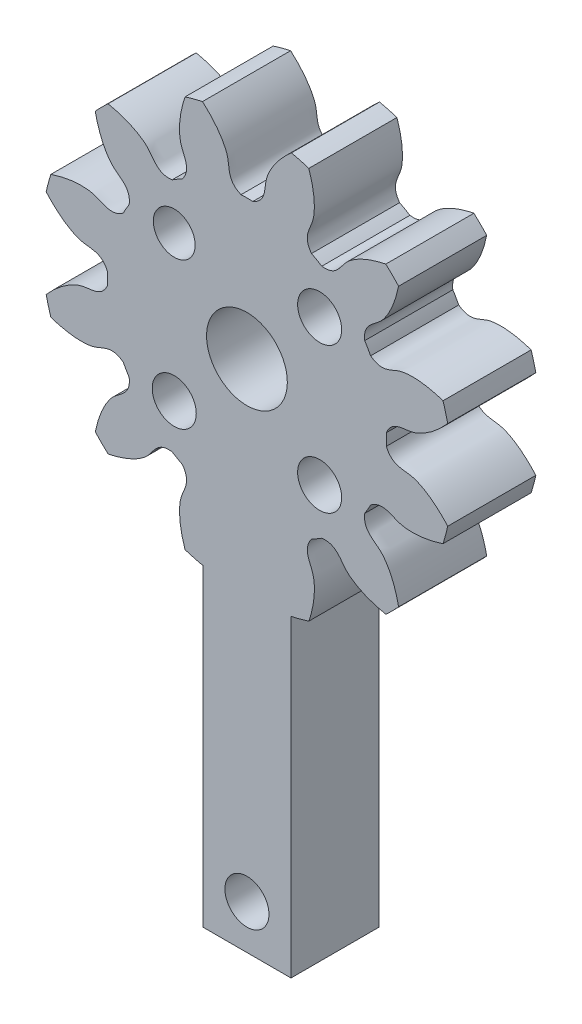
from build123d import *

# Parameters (mm, degrees)
SKETCH_1_R               = 14
EXTRUDE_1_DEPTH          = 30
CUT_EXTRUDE_1_DEPTH      = 36.944401511
PATTERN_CIRCULAR_1_COUNT = 12
SKETCH_4_R               = 1.5
SKETCH_4_R_2             = 1.423680872
CUT_EXTRUDE_2_DEPTH      = 10
CUT_EXTRUDE_3_DEPTH      = 24
SKETCH_6_R               = 2.75
CUT_EXTRUDE_4_DEPTH      = 24
SKETCH_9_W               = 6
SKETCH_9_H               = 30
EXTRUDE_2_DEPTH          = 6
SKETCH_10_R              = 1.5
CUT_EXTRUDE_5_DEPTH      = 10


with BuildPart() as part:
    # 草图1 → 凸台-拉伸1 (new body)
    with BuildSketch(Plane.XY):
        Circle(SKETCH_1_R)
    extrude(amount=EXTRUDE_1_DEPTH)

    # 草图2 → 切除-拉伸1 (cut, through all)
    with BuildSketch(Plane.XY):
        with BuildLine():
            ThreePointArc((0.401680225, 9.491504254), (0, 9.5), (-0.401680225, 9.491504254))
            add(Edge.make_bspline(
                [(-0.401680225, 9.491504254), (-1.361577738, 9.898614926), (-1.148746958, 10.689637365), (-1.352304376, 11.378961155), (-1.365247708, 11.419811475), (-1.380454501, 11.46466685), (-1.398085738, 11.513452175), (-1.41830525, 11.566086477), (-1.441273032, 11.622484138), (-1.467147122, 11.682554592), (-1.496082862, 11.746202504), (-1.528232954, 11.813327799), (-1.563747275, 11.883825742), (-1.602772771, 11.957587012), (-1.645453327, 12.034497774), (-1.691929648, 12.114439762), (-1.742339142, 12.197290357), (-1.796815797, 12.282922678), (-1.855490069, 12.371205667), (-1.918488769, 12.462004178), (-1.985934952, 12.555179076), (-2.057947808, 12.650587329), (-2.134642556, 12.748082111), (-2.216130341, 12.847512903), (-2.302518131, 12.948725598), (-2.39390862, 13.051562605), (-2.490400133, 13.155862967), (-2.59208653, 13.261462464), (-2.699057115, 13.368193734), (-2.811396554, 13.475886387), (-2.929184784, 13.584367126), (-3.052496933, 13.693459866), (-3.181403243, 13.802985862), (-3.31596899, 13.912763828), (-3.456254416, 14.02261007), (-3.602314655, 14.132338614), (-3.754199671, 14.241761336), (-3.911954189, 14.350688096), (-4.07561764, 14.458926871), (-4.2452241, 14.566283893), (-4.420802241, 14.672563788), (-4.602375278, 14.77756971), (-4.789960922, 14.881103487), (-4.983571339, 14.98296576), (-5.183213107, 15.082956125), (-5.388887185, 15.18087328), (-5.600588875, 15.276515169), (-5.818307792, 15.369679124), (-6.042027853, 15.460162018), (-6.27172721, 15.547760413), (-6.588759411, 15.661455917), (-6.8311872, 15.740202816), (-6.995210805, 15.78994182)],
                knots=[0, 0, 0, 0, 0.218015236, 0.222043642, 0.226545979, 0.231522246, 0.236972443, 0.24289657, 0.249294627, 0.256166614, 0.263512532, 0.271332379, 0.279626157, 0.288393865, 0.297635503, 0.307351072, 0.31754057, 0.328203999, 0.339341357, 0.350952646, 0.363037866, 0.375597015, 0.388630094, 0.402137104, 0.416118043, 0.430572913, 0.445501713, 0.460904444, 0.476781104, 0.493131694, 0.509956215, 0.527254666, 0.545027047, 0.563273358, 0.581993599, 0.601187771, 0.620855872, 0.640997904, 0.661613866, 0.682703758, 0.704267581, 0.726305333, 0.748817015, 0.771802628, 0.795262171, 0.819195644, 0.843603047, 0.868484381, 0.893839644, 0.919668838, 0.945971962, 1, 1, 1, 1], degree=3))
            ThreePointArc((-6.995210805, 15.78994182), (0, 17.270067658), (6.995210805, 15.78994182))
            add(Edge.make_bspline(
                [(0.401680225, 9.491504254), (1.361577738, 9.898614926), (1.148746958, 10.689637365), (1.352304376, 11.378961155), (1.365247708, 11.419811475), (1.380454501, 11.46466685), (1.398085738, 11.513452175), (1.41830525, 11.566086477), (1.441273032, 11.622484138), (1.467147122, 11.682554592), (1.496082862, 11.746202504), (1.528232954, 11.813327799), (1.563747275, 11.883825742), (1.602772771, 11.957587012), (1.645453327, 12.034497774), (1.691929648, 12.114439762), (1.742339142, 12.197290357), (1.796815797, 12.282922678), (1.855490069, 12.371205667), (1.918488769, 12.462004178), (1.985934952, 12.555179076), (2.057947808, 12.650587329), (2.134642556, 12.748082111), (2.216130341, 12.847512903), (2.302518131, 12.948725598), (2.39390862, 13.051562605), (2.490400133, 13.155862967), (2.59208653, 13.261462464), (2.699057115, 13.368193734), (2.811396554, 13.475886387), (2.929184784, 13.584367126), (3.052496933, 13.693459866), (3.181403243, 13.802985862), (3.31596899, 13.912763828), (3.456254416, 14.02261007), (3.602314655, 14.132338614), (3.754199671, 14.241761336), (3.911954189, 14.350688096), (4.07561764, 14.458926871), (4.2452241, 14.566283893), (4.420802241, 14.672563788), (4.602375278, 14.77756971), (4.789960922, 14.881103487), (4.983571339, 14.98296576), (5.183213107, 15.082956125), (5.388887185, 15.18087328), (5.600588875, 15.276515169), (5.818307792, 15.369679124), (6.042027853, 15.460162018), (6.27172721, 15.547760413), (6.588759411, 15.661455917), (6.8311872, 15.740202816), (6.995210805, 15.78994182)],
                knots=[0, 0, 0, 0, 0.218015236, 0.222043642, 0.226545979, 0.231522246, 0.236972443, 0.24289657, 0.249294627, 0.256166614, 0.263512532, 0.271332379, 0.279626157, 0.288393865, 0.297635503, 0.307351072, 0.31754057, 0.328203999, 0.339341357, 0.350952646, 0.363037866, 0.375597015, 0.388630094, 0.402137104, 0.416118043, 0.430572913, 0.445501713, 0.460904444, 0.476781104, 0.493131694, 0.509956215, 0.527254666, 0.545027047, 0.563273358, 0.581993599, 0.601187771, 0.620855872, 0.640997904, 0.661613866, 0.682703758, 0.704267581, 0.726305333, 0.748817015, 0.771802628, 0.795262171, 0.819195644, 0.843603047, 0.868484381, 0.893839644, 0.919668838, 0.945971962, 1, 1, 1, 1], degree=3))
        make_face()
    cut_extrude_1 = extrude(amount=CUT_EXTRUDE_1_DEPTH, mode=Mode.SUBTRACT)

    # 阵列(圆周)1: 切除-拉伸1 ×12 about axis
    pattern_circular_1_axis = Axis((0, 0, -1.50000125), (0, 0, 1))
    for i in range(1, PATTERN_CIRCULAR_1_COUNT):
        add(cut_extrude_1.rotate(pattern_circular_1_axis, i * 360 / PATTERN_CIRCULAR_1_COUNT), mode=Mode.SUBTRACT)

    # 草图4 → 切除-拉伸2 (cut)
    with BuildSketch(Plane.XY.offset(30)):
        with Locations((4.95, 4.95)):
            Circle(SKETCH_4_R)
        with Locations((4.95, -4.95)):
            Circle(SKETCH_4_R)
        with Locations((-4.95, -4.95)):
            Circle(SKETCH_4_R)
        with Locations((-4.95, 4.95)):
            Circle(SKETCH_4_R_2)
    extrude(amount=-CUT_EXTRUDE_2_DEPTH, mode=Mode.SUBTRACT)

    # 草图5 → 切除-拉伸3 (cut)
    with BuildSketch(Plane(origin=(0, 0, 0), x_dir=(-1, 0, 0), z_dir=(0, 0, -1))):
        with BuildLine():
            ThreePointArc((5.093617406, 8.019043691), (4.75, 8.227241336), (4.397886848, 8.420723916))
            add(Edge.make_bspline(
                [(4.397886848, 8.420723916), (3.770146552, 9.253240857), (4.349974635, 9.831870994), (4.52204915, 10.545970243), (4.538144761, 10.623261245), (4.555989488, 10.730054867), (4.571840145, 10.855376167), (4.584238126, 10.99920835), (4.59172634, 11.161446862), (4.592851082, 11.341900315), (4.586167374, 11.540290435), (4.570243427, 11.756252545), (4.543665279, 11.989336212), (4.505041355, 12.239006133), (4.453006992, 12.504643256), (4.386228899, 12.785546114), (4.306544015, 13.06975296), (4.24565022, 13.259118002), (4.214462671, 13.350591912)],
                knots=[0, 0, 0, 0, 0.218015236, 0.222043642, 0.231522246, 0.24289657, 0.256166614, 0.271332379, 0.288393865, 0.307351072, 0.328203999, 0.350952646, 0.375597015, 0.402137104, 0.430572913, 0.460904444, 0.493131694, 0.523595567, 0.523595567, 0.523595567, 0.523595567], degree=3))
            ThreePointArc((4.214462671, 13.350591912), (3.623466631, 13.522961568), (3.02546422, 13.669183087))
            add(Edge.make_bspline(
                [(3.02546422, 13.669183087), (2.913673684, 13.571409302), (2.731554989, 13.403302075), (2.492448157, 13.160132848), (2.304461996, 12.953014593), (2.136483862, 12.752388805), (1.987675315, 12.559502197), (1.857131035, 12.375544097), (1.743882195, 12.201643116), (1.646899875, 12.038864017), (1.565098659, 11.888204746), (1.497340348, 11.750593659), (1.45006317, 11.644068427), (1.411783535, 11.550072327), (1.381482721, 11.469086303), (1.35677568, 11.394102713), (1.148746958, 10.689637365), (1.361577738, 9.898614926), (0.401680225, 9.491504254)],
                knots=[0.476404433, 0.476404433, 0.476404433, 0.476404433, 0.523218896, 0.554498287, 0.583881957, 0.611369906, 0.636962134, 0.660658643, 0.68245943, 0.702364497, 0.720373843, 0.736487468, 0.750705373, 0.75710343, 0.768477754, 0.777956358, 0.781984764, 1, 1, 1, 1], degree=3))
            ThreePointArc((0.401680225, 9.491504254), (0, 9.5), (-0.401680225, 9.491504254))
            add(Edge.make_bspline(
                [(-0.401680225, 9.491504254), (-1.361577738, 9.898614926), (-1.148746958, 10.689637365), (-1.35677568, 11.394102713), (-1.381481974, 11.46908649), (-1.419424798, 11.570494842), (-1.468358376, 11.686951601), (-1.529537501, 11.817712915), (-1.604171774, 11.961959695), (-1.693424445, 12.118799341), (-1.798407765, 12.287268371), (-1.920179363, 12.466335071), (-2.059738548, 12.654902373), (-2.218022808, 12.851810906), (-2.39590445, 13.055842221), (-2.594187404, 13.265722186), (-2.805299961, 13.472010092), (-2.952718055, 13.605558131), (-3.02546422, 13.669183087)],
                knots=[0, 0, 0, 0, 0.218015236, 0.222043642, 0.231522246, 0.24289657, 0.256166614, 0.271332379, 0.288393865, 0.307351072, 0.328203999, 0.350952646, 0.375597015, 0.402137104, 0.430572913, 0.460904444, 0.493131694, 0.523595567, 0.523595567, 0.523595567, 0.523595567], degree=3))
            ThreePointArc((-3.02546422, 13.669183087), (-3.623466631, 13.522961568), (-4.214462671, 13.350591912))
            add(Edge.make_bspline(
                [(-4.214462671, 13.350591912), (-4.262389222, 13.210022063), (-4.336055025, 12.973377586), (-4.421543002, 12.643233442), (-4.480784666, 12.369870692), (-4.525945103, 12.112134595), (-4.558373781, 11.870685619), (-4.579449393, 11.646101091), (-4.590575276, 11.438874004), (-4.593174879, 11.249412009), (-4.588687175, 11.078036645), (-4.57856205, 10.924982792), (-4.566242671, 10.809090647), (-4.552395758, 10.708547818), (-4.53814402, 10.623261457), (-4.52204915, 10.545970243), (-4.349974635, 9.831870994), (-3.770146552, 9.253240857), (-4.397886848, 8.420723916)],
                knots=[0.476404433, 0.476404433, 0.476404433, 0.476404433, 0.523218896, 0.554498287, 0.583881957, 0.611369906, 0.636962134, 0.660658643, 0.68245943, 0.702364497, 0.720373843, 0.736487468, 0.750705373, 0.75710343, 0.768477754, 0.777956358, 0.781984764, 1, 1, 1, 1], degree=3))
            ThreePointArc((-4.397886848, 8.420723916), (-4.75, 8.227241336), (-5.093617406, 8.019043691))
            add(Edge.make_bspline(
                [(-5.093617406, 8.019043691), (-6.128468373, 7.891663119), (-6.33966273, 8.683124036), (-6.872053563, 9.189194563), (-6.930941729, 9.241779272), (-7.014505355, 9.310630069), (-7.115111456, 9.387017791), (-7.23347479, 9.469670849), (-7.370233356, 9.557275088), (-7.525948259, 9.64847587), (-7.701100996, 9.741882669), (-7.896091644, 9.836073182), (-8.111237094, 9.929597664), (-8.346769551, 10.020983326), (-8.602835229, 10.108738806), (-8.879493287, 10.191358711), (-9.165466077, 10.264453), (-9.359907912, 10.306399947), (-9.454720416, 10.325127692)],
                knots=[0, 0, 0, 0, 0.218015236, 0.222043642, 0.231522246, 0.24289657, 0.256166614, 0.271332379, 0.288393865, 0.307351072, 0.328203999, 0.350952646, 0.375597015, 0.402137104, 0.430572913, 0.460904444, 0.493131694, 0.523595567, 0.523595567, 0.523595567, 0.523595567], degree=3))
            ThreePointArc((-9.454720416, 10.325127692), (-9.899494937, 9.899494937), (-10.325127692, 9.454720416))
            add(Edge.make_bspline(
                [(-10.325127692, 9.454720416), (-10.296348379, 9.30902008), (-10.241822597, 9.06724705), (-10.150785285, 8.738589846), (-10.065408695, 8.472229927), (-9.975650733, 8.226443701), (-9.883010304, 8.001128416), (-9.788970056, 7.796094703), (-9.694991809, 7.61106784), (-9.602512134, 7.445689138), (-9.512937986, 7.299517571), (-9.427642444, 7.172031609), (-9.359027476, 7.077825756), (-9.296764283, 6.997676569), (-9.241778736, 6.930942283), (-9.189194563, 6.872053563), (-8.683124036, 6.33966273), (-7.891663119, 6.128468373), (-8.019043691, 5.093617406)],
                knots=[0.476404433, 0.476404433, 0.476404433, 0.476404433, 0.523218896, 0.554498287, 0.583881957, 0.611369906, 0.636962134, 0.660658643, 0.68245943, 0.702364497, 0.720373843, 0.736487468, 0.750705373, 0.75710343, 0.768477754, 0.777956358, 0.781984764, 1, 1, 1, 1], degree=3))
            ThreePointArc((-8.019043691, 5.093617406), (-8.227241336, 4.75), (-8.420723916, 4.397886848))
            add(Edge.make_bspline(
                [(-8.420723916, 4.397886848), (-9.253240857, 3.770146552), (-9.831870994, 4.349974635), (-10.545970243, 4.52204915), (-10.623261245, 4.538144761), (-10.730054867, 4.555989488), (-10.855376167, 4.571840145), (-10.99920835, 4.584238126), (-11.161446862, 4.59172634), (-11.341900315, 4.592851082), (-11.540290435, 4.586167374), (-11.756252545, 4.570243427), (-11.989336212, 4.543665279), (-12.239006133, 4.505041355), (-12.504643256, 4.453006992), (-12.785546114, 4.386228899), (-13.06975296, 4.306544015), (-13.259118002, 4.24565022), (-13.350591912, 4.214462671)],
                knots=[0, 0, 0, 0, 0.218015236, 0.222043642, 0.231522246, 0.24289657, 0.256166614, 0.271332379, 0.288393865, 0.307351072, 0.328203999, 0.350952646, 0.375597015, 0.402137104, 0.430572913, 0.460904444, 0.493131694, 0.523595567, 0.523595567, 0.523595567, 0.523595567], degree=3))
            ThreePointArc((-13.350591912, 4.214462671), (-13.522961568, 3.623466631), (-13.669183087, 3.02546422))
            add(Edge.make_bspline(
                [(-13.669183087, 3.02546422), (-13.571409302, 2.913673684), (-13.403302075, 2.731554989), (-13.160132848, 2.492448157), (-12.953014593, 2.304461996), (-12.752388805, 2.136483862), (-12.559502197, 1.987675315), (-12.375544097, 1.857131035), (-12.201643116, 1.743882195), (-12.038864017, 1.646899875), (-11.888204746, 1.565098659), (-11.750593659, 1.497340348), (-11.644068427, 1.45006317), (-11.550072327, 1.411783535), (-11.469086303, 1.381482721), (-11.394102713, 1.35677568), (-10.689637365, 1.148746958), (-9.898614926, 1.361577738), (-9.491504254, 0.401680225)],
                knots=[0.476404433, 0.476404433, 0.476404433, 0.476404433, 0.523218896, 0.554498287, 0.583881957, 0.611369906, 0.636962134, 0.660658643, 0.68245943, 0.702364497, 0.720373843, 0.736487468, 0.750705373, 0.75710343, 0.768477754, 0.777956358, 0.781984764, 1, 1, 1, 1], degree=3))
            ThreePointArc((-9.491504254, 0.401680225), (-9.5, 0), (-9.491504254, -0.401680225))
            add(Edge.make_bspline(
                [(-9.491504254, -0.401680225), (-9.898614926, -1.361577738), (-10.689637365, -1.148746958), (-11.394102713, -1.35677568), (-11.46908649, -1.381481974), (-11.570494842, -1.419424798), (-11.686951601, -1.468358376), (-11.817712915, -1.529537501), (-11.961959695, -1.604171774), (-12.118799341, -1.693424445), (-12.287268371, -1.798407765), (-12.466335071, -1.920179363), (-12.654902373, -2.059738548), (-12.851810906, -2.218022808), (-13.055842221, -2.39590445), (-13.265722186, -2.594187404), (-13.472010092, -2.805299961), (-13.605558131, -2.952718055), (-13.669183087, -3.02546422)],
                knots=[0, 0, 0, 0, 0.218015236, 0.222043642, 0.231522246, 0.24289657, 0.256166614, 0.271332379, 0.288393865, 0.307351072, 0.328203999, 0.350952646, 0.375597015, 0.402137104, 0.430572913, 0.460904444, 0.493131694, 0.523595567, 0.523595567, 0.523595567, 0.523595567], degree=3))
            ThreePointArc((-13.669183087, -3.02546422), (-13.522961568, -3.623466631), (-13.350591912, -4.214462671))
            add(Edge.make_bspline(
                [(-13.350591912, -4.214462671), (-13.210022063, -4.262389222), (-12.973377586, -4.336055025), (-12.643233442, -4.421543002), (-12.369870692, -4.480784666), (-12.112134595, -4.525945103), (-11.870685619, -4.558373781), (-11.646101091, -4.579449393), (-11.438874004, -4.590575276), (-11.249412009, -4.593174879), (-11.078036645, -4.588687175), (-10.924982792, -4.57856205), (-10.809090647, -4.566242671), (-10.708547818, -4.552395758), (-10.623261457, -4.53814402), (-10.545970243, -4.52204915), (-9.831870994, -4.349974635), (-9.253240857, -3.770146552), (-8.420723916, -4.397886848)],
                knots=[0.476404433, 0.476404433, 0.476404433, 0.476404433, 0.523218896, 0.554498287, 0.583881957, 0.611369906, 0.636962134, 0.660658643, 0.68245943, 0.702364497, 0.720373843, 0.736487468, 0.750705373, 0.75710343, 0.768477754, 0.777956358, 0.781984764, 1, 1, 1, 1], degree=3))
            ThreePointArc((-8.420723916, -4.397886848), (-8.227241336, -4.75), (-8.019043691, -5.093617406))
            add(Edge.make_bspline(
                [(-8.019043691, -5.093617406), (-7.891663119, -6.128468373), (-8.683124036, -6.33966273), (-9.189194563, -6.872053563), (-9.241779272, -6.930941729), (-9.310630069, -7.014505355), (-9.387017791, -7.115111456), (-9.469670849, -7.23347479), (-9.557275088, -7.370233356), (-9.64847587, -7.525948259), (-9.741882669, -7.701100996), (-9.836073182, -7.896091644), (-9.929597664, -8.111237094), (-10.020983326, -8.346769551), (-10.108738806, -8.602835229), (-10.191358711, -8.879493287), (-10.264453, -9.165466077), (-10.306399947, -9.359907912), (-10.325127692, -9.454720416)],
                knots=[0, 0, 0, 0, 0.218015236, 0.222043642, 0.231522246, 0.24289657, 0.256166614, 0.271332379, 0.288393865, 0.307351072, 0.328203999, 0.350952646, 0.375597015, 0.402137104, 0.430572913, 0.460904444, 0.493131694, 0.523595567, 0.523595567, 0.523595567, 0.523595567], degree=3))
            ThreePointArc((-10.325127692, -9.454720416), (-9.899494937, -9.899494937), (-9.454720416, -10.325127692))
            add(Edge.make_bspline(
                [(-9.454720416, -10.325127692), (-9.30902008, -10.296348379), (-9.06724705, -10.241822597), (-8.738589846, -10.150785285), (-8.472229927, -10.065408695), (-8.226443701, -9.975650733), (-8.001128416, -9.883010304), (-7.796094703, -9.788970056), (-7.61106784, -9.694991809), (-7.445689138, -9.602512134), (-7.299517571, -9.512937986), (-7.172031609, -9.427642444), (-7.077825756, -9.359027476), (-6.997676569, -9.296764283), (-6.930942283, -9.241778736), (-6.872053563, -9.189194563), (-6.33966273, -8.683124036), (-6.128468373, -7.891663119), (-5.093617406, -8.019043691)],
                knots=[0.476404433, 0.476404433, 0.476404433, 0.476404433, 0.523218896, 0.554498287, 0.583881957, 0.611369906, 0.636962134, 0.660658643, 0.68245943, 0.702364497, 0.720373843, 0.736487468, 0.750705373, 0.75710343, 0.768477754, 0.777956358, 0.781984764, 1, 1, 1, 1], degree=3))
            ThreePointArc((-5.093617406, -8.019043691), (-4.75, -8.227241336), (-4.397886848, -8.420723916))
            add(Edge.make_bspline(
                [(-4.397886848, -8.420723916), (-3.770146552, -9.253240857), (-4.349974635, -9.831870994), (-4.52204915, -10.545970243), (-4.538144761, -10.623261245), (-4.555989488, -10.730054867), (-4.571840145, -10.855376167), (-4.584238126, -10.99920835), (-4.59172634, -11.161446862), (-4.592851082, -11.341900315), (-4.586167374, -11.540290435), (-4.570243427, -11.756252545), (-4.543665279, -11.989336212), (-4.505041355, -12.239006133), (-4.453006992, -12.504643256), (-4.386228899, -12.785546114), (-4.306544015, -13.06975296), (-4.24565022, -13.259118002), (-4.214462671, -13.350591912)],
                knots=[0, 0, 0, 0, 0.218015236, 0.222043642, 0.231522246, 0.24289657, 0.256166614, 0.271332379, 0.288393865, 0.307351072, 0.328203999, 0.350952646, 0.375597015, 0.402137104, 0.430572913, 0.460904444, 0.493131694, 0.523595567, 0.523595567, 0.523595567, 0.523595567], degree=3))
            ThreePointArc((-4.214462671, -13.350591912), (-3.623466631, -13.522961568), (-3.02546422, -13.669183087))
            add(Edge.make_bspline(
                [(-3.02546422, -13.669183087), (-2.913673684, -13.571409302), (-2.731554989, -13.403302075), (-2.492448157, -13.160132848), (-2.304461996, -12.953014593), (-2.136483862, -12.752388805), (-1.987675315, -12.559502197), (-1.857131035, -12.375544097), (-1.743882195, -12.201643116), (-1.646899875, -12.038864017), (-1.565098659, -11.888204746), (-1.497340348, -11.750593659), (-1.45006317, -11.644068427), (-1.411783535, -11.550072327), (-1.381482721, -11.469086303), (-1.35677568, -11.394102713), (-1.148746958, -10.689637365), (-1.361577738, -9.898614926), (-0.401680225, -9.491504254)],
                knots=[0.476404433, 0.476404433, 0.476404433, 0.476404433, 0.523218896, 0.554498287, 0.583881957, 0.611369906, 0.636962134, 0.660658643, 0.68245943, 0.702364497, 0.720373843, 0.736487468, 0.750705373, 0.75710343, 0.768477754, 0.777956358, 0.781984764, 1, 1, 1, 1], degree=3))
            ThreePointArc((-0.401680225, -9.491504254), (0, -9.5), (0.401680225, -9.491504254))
            add(Edge.make_bspline(
                [(0.401680225, -9.491504254), (1.361577738, -9.898614926), (1.148746958, -10.689637365), (1.35677568, -11.394102713), (1.381481974, -11.46908649), (1.419424798, -11.570494842), (1.468358376, -11.686951601), (1.529537501, -11.817712915), (1.604171774, -11.961959695), (1.693424445, -12.118799341), (1.798407765, -12.287268371), (1.920179363, -12.466335071), (2.059738548, -12.654902373), (2.218022808, -12.851810906), (2.39590445, -13.055842221), (2.594187404, -13.265722186), (2.805299961, -13.472010092), (2.952718055, -13.605558131), (3.02546422, -13.669183087)],
                knots=[0, 0, 0, 0, 0.218015236, 0.222043642, 0.231522246, 0.24289657, 0.256166614, 0.271332379, 0.288393865, 0.307351072, 0.328203999, 0.350952646, 0.375597015, 0.402137104, 0.430572913, 0.460904444, 0.493131694, 0.523595567, 0.523595567, 0.523595567, 0.523595567], degree=3))
            ThreePointArc((3.02546422, -13.669183087), (3.623466631, -13.522961568), (4.214462671, -13.350591912))
            add(Edge.make_bspline(
                [(4.214462671, -13.350591912), (4.262389222, -13.210022063), (4.336055025, -12.973377586), (4.421543002, -12.643233442), (4.480784666, -12.369870692), (4.525945103, -12.112134595), (4.558373781, -11.870685619), (4.579449393, -11.646101091), (4.590575276, -11.438874004), (4.593174879, -11.249412009), (4.588687175, -11.078036645), (4.57856205, -10.924982792), (4.566242671, -10.809090647), (4.552395758, -10.708547818), (4.53814402, -10.623261457), (4.52204915, -10.545970243), (4.349974635, -9.831870994), (3.770146552, -9.253240857), (4.397886848, -8.420723916)],
                knots=[0.476404433, 0.476404433, 0.476404433, 0.476404433, 0.523218896, 0.554498287, 0.583881957, 0.611369906, 0.636962134, 0.660658643, 0.68245943, 0.702364497, 0.720373843, 0.736487468, 0.750705373, 0.75710343, 0.768477754, 0.777956358, 0.781984764, 1, 1, 1, 1], degree=3))
            ThreePointArc((4.397886848, -8.420723916), (4.75, -8.227241336), (5.093617406, -8.019043691))
            add(Edge.make_bspline(
                [(5.093617406, -8.019043691), (6.128468373, -7.891663119), (6.33966273, -8.683124036), (6.872053563, -9.189194563), (6.930941729, -9.241779272), (7.014505355, -9.310630069), (7.115111456, -9.387017791), (7.23347479, -9.469670849), (7.370233356, -9.557275088), (7.525948259, -9.64847587), (7.701100996, -9.741882669), (7.896091644, -9.836073182), (8.111237094, -9.929597664), (8.346769551, -10.020983326), (8.602835229, -10.108738806), (8.879493287, -10.191358711), (9.165466077, -10.264453), (9.359907912, -10.306399947), (9.454720416, -10.325127692)],
                knots=[0, 0, 0, 0, 0.218015236, 0.222043642, 0.231522246, 0.24289657, 0.256166614, 0.271332379, 0.288393865, 0.307351072, 0.328203999, 0.350952646, 0.375597015, 0.402137104, 0.430572913, 0.460904444, 0.493131694, 0.523595567, 0.523595567, 0.523595567, 0.523595567], degree=3))
            ThreePointArc((9.454720416, -10.325127692), (9.899494937, -9.899494937), (10.325127692, -9.454720416))
            add(Edge.make_bspline(
                [(10.325127692, -9.454720416), (10.296348379, -9.30902008), (10.241822597, -9.06724705), (10.150785285, -8.738589846), (10.065408695, -8.472229927), (9.975650733, -8.226443701), (9.883010304, -8.001128416), (9.788970056, -7.796094703), (9.694991809, -7.61106784), (9.602512134, -7.445689138), (9.512937986, -7.299517571), (9.427642444, -7.172031609), (9.359027476, -7.077825756), (9.296764283, -6.997676569), (9.241778736, -6.930942283), (9.189194563, -6.872053563), (8.683124036, -6.33966273), (7.891663119, -6.128468373), (8.019043691, -5.093617406)],
                knots=[0.476404433, 0.476404433, 0.476404433, 0.476404433, 0.523218896, 0.554498287, 0.583881957, 0.611369906, 0.636962134, 0.660658643, 0.68245943, 0.702364497, 0.720373843, 0.736487468, 0.750705373, 0.75710343, 0.768477754, 0.777956358, 0.781984764, 1, 1, 1, 1], degree=3))
            ThreePointArc((8.019043691, -5.093617406), (8.227241336, -4.75), (8.420723916, -4.397886848))
            add(Edge.make_bspline(
                [(8.420723916, -4.397886848), (9.253240857, -3.770146552), (9.831870994, -4.349974635), (10.545970243, -4.52204915), (10.623261245, -4.538144761), (10.730054867, -4.555989488), (10.855376167, -4.571840145), (10.99920835, -4.584238126), (11.161446862, -4.59172634), (11.341900315, -4.592851082), (11.540290435, -4.586167374), (11.756252545, -4.570243427), (11.989336212, -4.543665279), (12.239006133, -4.505041355), (12.504643256, -4.453006992), (12.785546114, -4.386228899), (13.06975296, -4.306544015), (13.259118002, -4.24565022), (13.350591912, -4.214462671)],
                knots=[0, 0, 0, 0, 0.218015236, 0.222043642, 0.231522246, 0.24289657, 0.256166614, 0.271332379, 0.288393865, 0.307351072, 0.328203999, 0.350952646, 0.375597015, 0.402137104, 0.430572913, 0.460904444, 0.493131694, 0.523595567, 0.523595567, 0.523595567, 0.523595567], degree=3))
            ThreePointArc((13.350591912, -4.214462671), (13.522961568, -3.623466631), (13.669183087, -3.02546422))
            add(Edge.make_bspline(
                [(13.669183087, -3.02546422), (13.571409302, -2.913673684), (13.403302075, -2.731554989), (13.160132848, -2.492448157), (12.953014593, -2.304461996), (12.752388805, -2.136483862), (12.559502197, -1.987675315), (12.375544097, -1.857131035), (12.201643116, -1.743882195), (12.038864017, -1.646899875), (11.888204746, -1.565098659), (11.750593659, -1.497340348), (11.644068427, -1.45006317), (11.550072327, -1.411783535), (11.469086303, -1.381482721), (11.394102713, -1.35677568), (10.689637365, -1.148746958), (9.898614926, -1.361577738), (9.491504254, -0.401680225)],
                knots=[0.476404433, 0.476404433, 0.476404433, 0.476404433, 0.523218896, 0.554498287, 0.583881957, 0.611369906, 0.636962134, 0.660658643, 0.68245943, 0.702364497, 0.720373843, 0.736487468, 0.750705373, 0.75710343, 0.768477754, 0.777956358, 0.781984764, 1, 1, 1, 1], degree=3))
            ThreePointArc((9.491504254, -0.401680225), (9.5, 0), (9.491504254, 0.401680225))
            add(Edge.make_bspline(
                [(9.491504254, 0.401680225), (9.898614926, 1.361577738), (10.689637365, 1.148746958), (11.394102713, 1.35677568), (11.46908649, 1.381481974), (11.570494842, 1.419424798), (11.686951601, 1.468358376), (11.817712915, 1.529537501), (11.961959695, 1.604171774), (12.118799341, 1.693424445), (12.287268371, 1.798407765), (12.466335071, 1.920179363), (12.654902373, 2.059738548), (12.851810906, 2.218022808), (13.055842221, 2.39590445), (13.265722186, 2.594187404), (13.472010092, 2.805299961), (13.605558131, 2.952718055), (13.669183087, 3.02546422)],
                knots=[0, 0, 0, 0, 0.218015236, 0.222043642, 0.231522246, 0.24289657, 0.256166614, 0.271332379, 0.288393865, 0.307351072, 0.328203999, 0.350952646, 0.375597015, 0.402137104, 0.430572913, 0.460904444, 0.493131694, 0.523595567, 0.523595567, 0.523595567, 0.523595567], degree=3))
            ThreePointArc((13.669183087, 3.02546422), (13.522961568, 3.623466631), (13.350591912, 4.214462671))
            add(Edge.make_bspline(
                [(13.350591912, 4.214462671), (13.210022063, 4.262389222), (12.973377586, 4.336055025), (12.643233442, 4.421543002), (12.369870692, 4.480784666), (12.112134595, 4.525945103), (11.870685619, 4.558373781), (11.646101091, 4.579449393), (11.438874004, 4.590575276), (11.249412009, 4.593174879), (11.078036645, 4.588687175), (10.924982792, 4.57856205), (10.809090647, 4.566242671), (10.708547818, 4.552395758), (10.623261457, 4.53814402), (10.545970243, 4.52204915), (9.831870994, 4.349974635), (9.253240857, 3.770146552), (8.420723916, 4.397886848)],
                knots=[0.476404433, 0.476404433, 0.476404433, 0.476404433, 0.523218896, 0.554498287, 0.583881957, 0.611369906, 0.636962134, 0.660658643, 0.68245943, 0.702364497, 0.720373843, 0.736487468, 0.750705373, 0.75710343, 0.768477754, 0.777956358, 0.781984764, 1, 1, 1, 1], degree=3))
            ThreePointArc((8.420723916, 4.397886848), (8.227241336, 4.75), (8.019043691, 5.093617406))
            add(Edge.make_bspline(
                [(8.019043691, 5.093617406), (7.891663119, 6.128468373), (8.683124036, 6.33966273), (9.189194563, 6.872053563), (9.241779272, 6.930941729), (9.310630069, 7.014505355), (9.387017791, 7.115111456), (9.469670849, 7.23347479), (9.557275088, 7.370233356), (9.64847587, 7.525948259), (9.741882669, 7.701100996), (9.836073182, 7.896091644), (9.929597664, 8.111237094), (10.020983326, 8.346769551), (10.108738806, 8.602835229), (10.191358711, 8.879493287), (10.264453, 9.165466077), (10.306399947, 9.359907912), (10.325127692, 9.454720416)],
                knots=[0, 0, 0, 0, 0.218015236, 0.222043642, 0.231522246, 0.24289657, 0.256166614, 0.271332379, 0.288393865, 0.307351072, 0.328203999, 0.350952646, 0.375597015, 0.402137104, 0.430572913, 0.460904444, 0.493131694, 0.523595567, 0.523595567, 0.523595567, 0.523595567], degree=3))
            ThreePointArc((10.325127692, 9.454720416), (9.899494937, 9.899494937), (9.454720416, 10.325127692))
            add(Edge.make_bspline(
                [(9.454720416, 10.325127692), (9.30902008, 10.296348379), (9.06724705, 10.241822597), (8.738589846, 10.150785285), (8.472229927, 10.065408695), (8.226443701, 9.975650733), (8.001128416, 9.883010304), (7.796094703, 9.788970056), (7.61106784, 9.694991809), (7.445689138, 9.602512134), (7.299517571, 9.512937986), (7.172031609, 9.427642444), (7.077825756, 9.359027476), (6.997676569, 9.296764283), (6.930942283, 9.241778736), (6.872053563, 9.189194563), (6.33966273, 8.683124036), (6.128468373, 7.891663119), (5.093617406, 8.019043691)],
                knots=[0.476404433, 0.476404433, 0.476404433, 0.476404433, 0.523218896, 0.554498287, 0.583881957, 0.611369906, 0.636962134, 0.660658643, 0.68245943, 0.702364497, 0.720373843, 0.736487468, 0.750705373, 0.75710343, 0.768477754, 0.777956358, 0.781984764, 1, 1, 1, 1], degree=3))
        make_face()
    extrude(amount=-CUT_EXTRUDE_3_DEPTH, mode=Mode.SUBTRACT)

    # 草图6 → 切除-拉伸4 (cut)
    with BuildSketch(Plane.XY.offset(30)):
        Circle(SKETCH_6_R)
    extrude(amount=-CUT_EXTRUDE_4_DEPTH, mode=Mode.SUBTRACT)

    # 草图9 → 凸台-拉伸2 (add)
    with BuildSketch(Plane.XY.offset(30)):
        with Locations((0, -20)):
            Rectangle(SKETCH_9_W, SKETCH_9_H)
    extrude(amount=-EXTRUDE_2_DEPTH)

    # 草图10 → 切除-拉伸5 (cut)
    with BuildSketch(Plane.XY.offset(30)):
        with Locations((0, -32)):
            Circle(SKETCH_10_R)
    extrude(amount=-CUT_EXTRUDE_5_DEPTH, mode=Mode.SUBTRACT)


solid = part.part
